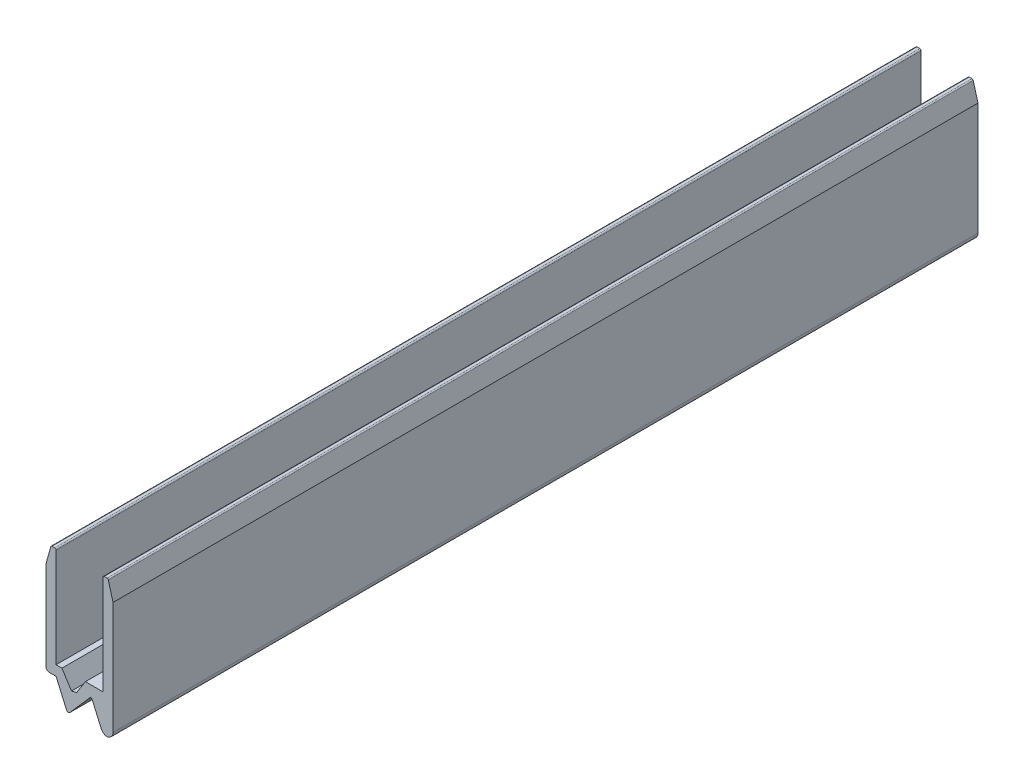
from build123d import *

# Parameters (mm, degrees)
BOSS_EXTRUDE1_DEPTH = 129
FILLET1_R           = 0.2
FILLET1_R_2         = 0.3
FILLET1_R_3         = 1
FILLET1_R_4         = 0.5
CHAMFER1_SIZE       = 0.8
CHAMFER1_SIZE2      = 0.601769912


with BuildPart() as part:
    # Sketch1 → Boss-Extrude1 (new body)
    with BuildSketch(Plane.XY):
        Polygon((1.5, 20.5), (1.5, 5.5), (2.375, 5.5), (4.125, 2.75), (5.875, 5.5), (8.5, 5.5), (8.5, 20.5), (9.25, 20.5), (10, 17.8), (10, 0), (8.5, 0), (6.75, 4), (3.25, 0), (1.5, 4), (0, 4), (0, 17.8), (0.75, 20.5), align=None)
    extrude(amount=BOSS_EXTRUDE1_DEPTH)

    # Fillet1
    # the kernel refuses this fillet: 1, 0.5, 0.3, 0.2 mm, written as the material it adds along each edge
    with BuildSketch(Plane(origin=(6.75, 4, 0), x_dir=(0.40081883401970875, -0.9161573349021888, 0), z_dir=(0, 0, 1))) as fillet1_piece_1:
        with BuildLine():
            CenterArc((FILLET1_R * 1.57528283018, -FILLET1_R), FILLET1_R, 90, 115.184697104)
            Line((FILLET1_R * 0.670342090327, -FILLET1_R * 1.42553760981), (0, 0))
            Line((0, 0), (FILLET1_R * 1.57528283018, 0))
        make_face()
    extrude(amount=129)
    # the kernel refuses this fillet: 1, 0.5, 0.3, 0.2 mm, written as the material it takes off along each edge
    with BuildSketch(Plane(origin=(3.25, 0, -1.181462123), x_dir=(0.6585046078685179, 0.752576694706878, 0), z_dir=(0, 0, 1))) as fillet1_2_piece_1:
        with BuildLine():
            CenterArc((FILLET1_R_2 * 1.57528283018, FILLET1_R_2), FILLET1_R_2, 154.815302896, 115.184697104)
            Line((FILLET1_R_2 * 0.670342090327, FILLET1_R_2 * 1.42553760981), (0, 0))
            Line((0, 0), (FILLET1_R_2 * 1.57528283018, 0))
        make_face()
    extrude(amount=131.362924245, mode=Mode.SUBTRACT)
    with BuildSketch(Plane(origin=(8.5, 0, -1.635038937), x_dir=(1, 0, 0), z_dir=(0, 0, 1))) as fillet1_2_piece_2:
        with BuildLine():
            CenterArc((FILLET1_R_3 * 0.654015574786, FILLET1_R_3), FILLET1_R_3, 203.629377731, 66.370622269)
            Line((-FILLET1_R_3 * 0.262141760116, FILLET1_R_3 * 0.59918116598), (0, 0))
            Line((0, 0), (FILLET1_R_3 * 0.654015574786, 0))
        make_face()
    extrude(amount=132.270077874, mode=Mode.SUBTRACT)
    with BuildSketch(Plane(origin=(10, 0, -2.5), x_dir=(0, 1, 0), z_dir=(0, 0, 1))) as fillet1_2_piece_3:
        with BuildLine():
            CenterArc((FILLET1_R_3, FILLET1_R_3), FILLET1_R_3, 180, 90)
            Line((0, FILLET1_R_3), (0, 0))
            Line((0, 0), (FILLET1_R_3, 0))
        make_face()
    extrude(amount=134, mode=Mode.SUBTRACT)
    with BuildSketch(Plane(origin=(0, 4, -1.25), x_dir=(1, 0, 0), z_dir=(0, 0, 1))) as fillet1_2_piece_4:
        with BuildLine():
            CenterArc((FILLET1_R_4, FILLET1_R_4), FILLET1_R_4, 180, 90)
            Line((0, FILLET1_R_4), (0, 0))
            Line((0, 0), (FILLET1_R_4, 0))
        make_face()
    extrude(amount=131.5, mode=Mode.SUBTRACT)
    with BuildSketch(Plane(origin=(9.25, 20.5, -0.380042825), x_dir=(-1, 0, 0), z_dir=(0, 0, 1))) as fillet1_2_piece_5:
        with BuildLine():
            CenterArc((FILLET1_R * 0.760085649571, FILLET1_R), FILLET1_R, 195.524110997, 74.475889003)
            Line((-FILLET1_R * 0.203432260059, FILLET1_R * 0.732356136214), (0, 0))
            Line((0, 0), (FILLET1_R * 0.760085649571, 0))
        make_face()
    extrude(amount=129.76008565, mode=Mode.SUBTRACT)
    with BuildSketch(Plane(origin=(8.5, 20.5, -0.5), x_dir=(0, -1, 0), z_dir=(0, 0, 1))) as fillet1_2_piece_6:
        with BuildLine():
            CenterArc((FILLET1_R, FILLET1_R), FILLET1_R, 180, 90)
            Line((0, FILLET1_R), (0, 0))
            Line((0, 0), (FILLET1_R, 0))
        make_face()
    extrude(amount=130, mode=Mode.SUBTRACT)
    with BuildSketch(Plane(origin=(1.5, 20.5, -0.5), x_dir=(0, -1, 0), z_dir=(0, 0, 1))) as fillet1_2_piece_7:
        with BuildLine():
            CenterArc((FILLET1_R, -FILLET1_R), FILLET1_R, 90, 90)
            Line((0, -FILLET1_R), (0, 0))
            Line((0, 0), (FILLET1_R, 0))
        make_face()
    extrude(amount=130, mode=Mode.SUBTRACT)
    with BuildSketch(Plane(origin=(0.75, 20.5, -0.380042825), x_dir=(1, 0, 0), z_dir=(0, 0, 1))) as fillet1_2_piece_8:
        with BuildLine():
            CenterArc((FILLET1_R * 0.760085649571, -FILLET1_R), FILLET1_R, 90, 74.475889003)
            Line((-FILLET1_R * 0.203432260059, -FILLET1_R * 0.732356136214), (0, 0))
            Line((0, 0), (FILLET1_R * 0.760085649571, 0))
        make_face()
    extrude(amount=129.76008565, mode=Mode.SUBTRACT)

    # Chamfer1
    chamfer1_edges = [part.edges().sort_by_distance(p)[0] for p in [
        (4.125, 2.75, 64.5),
    ]]
    chamfer1_side = [part.faces().sort_by_distance(p)[0] for p in [
        (5, 4.125, 64.5),
    ]]
    chamfer(chamfer1_edges, length=CHAMFER1_SIZE, length2=CHAMFER1_SIZE2, reference=chamfer1_side[0])


solid = part.part
